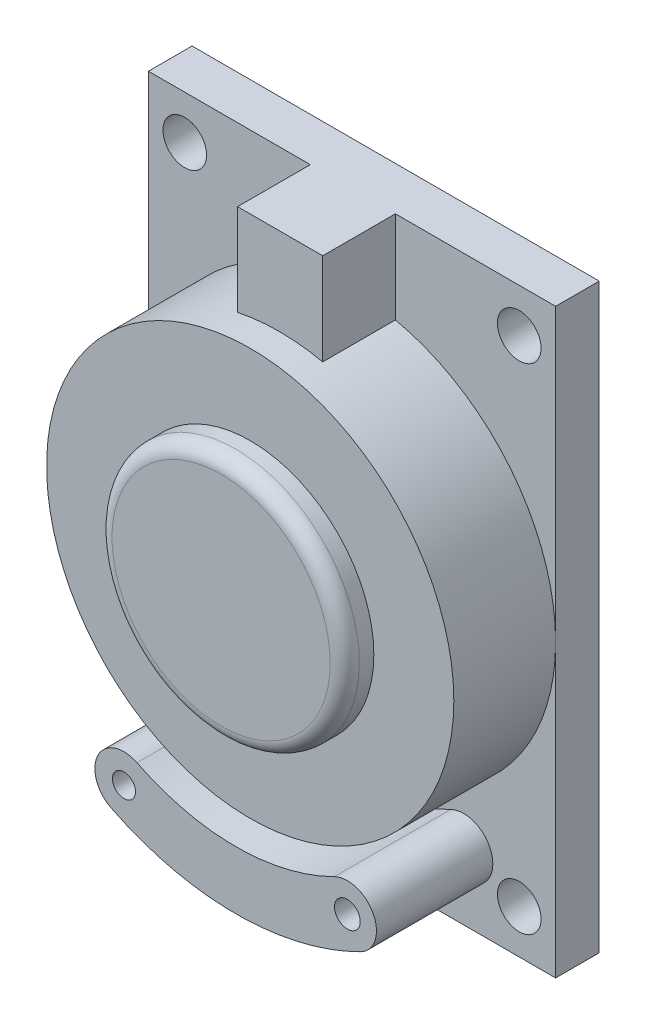
from build123d import *

# Parameters (mm, degrees)
SKETCH1_W           = 28
SKETCH1_H           = 40
BOSS_EXTRUDE1_DEPTH = 3
SKETCH2_R           = 14
BOSS_EXTRUDE2_DEPTH = 7
SKETCH3_R           = 8.5
BOSS_EXTRUDE3_DEPTH = 2
FILLET1_R           = 1
SKETCH4_R           = 0.884555984
SKETCH4_R_2         = 0.79363575
BOSS_EXTRUDE4_DEPTH = 8
SKETCH5_W           = 5.850646162
SKETCH5_H           = 7.111200286
BOSS_EXTRUDE5_DEPTH = 5
SKETCH6_R           = 1.5
CUT_EXTRUDE1_DEPTH  = 5
CUT_EXTRUDE2_DEPTH  = 1.5
CUT_EXTRUDE2_DRAFT  = -30
SKETCH8_R           = 6.5
BOSS_EXTRUDE6_DEPTH = 1
FILLET2_R           = 1


with BuildPart() as part:
    # Sketch1 → Boss-Extrude1 (new body)
    with BuildSketch(Plane.XY):
        Rectangle(SKETCH1_W, SKETCH1_H)
    extrude(amount=BOSS_EXTRUDE1_DEPTH)

    # Sketch2 → Boss-Extrude2 (add)
    with BuildSketch(Plane.XY.offset(3)):
        Circle(SKETCH2_R)
    extrude(amount=BOSS_EXTRUDE2_DEPTH)

    # Sketch3 → Boss-Extrude3 (add)
    with BuildSketch(Plane.XY.offset(10)):
        Circle(SKETCH3_R)
    extrude(amount=BOSS_EXTRUDE3_DEPTH)

    # Fillet1
    fillet1_edges = [part.edges().sort_by_distance(p)[0] for p in [
        (-8.5, 0, 12),
    ]]
    fillet(fillet1_edges, radius=FILLET1_R)

    # Sketch4 → Boss-Extrude4 (add)
    with BuildSketch(Plane.XY.offset(3)):
        with BuildLine():
            ThreePointArc((-8.575515757, -17.151031514), (0, -19.175436175), (8.575515757, -17.151031514))
            ThreePointArc((8.575515757, -17.151031514), (9.469942948, -14.467749941), (6.786661375, -13.57332275))
            ThreePointArc((6.786661375, -13.57332275), (0, -15.175436175), (-6.786661375, -13.57332275))
            ThreePointArc((-6.786661375, -13.57332275), (-9.469942948, -14.467749941), (-8.575515757, -17.151031514))
        make_face()
        with Locations((7.681088566, -15.362177132)):
            Circle(SKETCH4_R, mode=Mode.SUBTRACT)
        with Locations((-7.681088566, -15.362177132)):
            Circle(SKETCH4_R_2, mode=Mode.SUBTRACT)
    extrude(amount=BOSS_EXTRUDE4_DEPTH)

    # Sketch5 → Boss-Extrude5 (add)
    with BuildSketch(Plane.XY.offset(3)):
        with Locations((0.05792719, 16.444399857)):
            Rectangle(SKETCH5_W, SKETCH5_H)
    extrude(amount=BOSS_EXTRUDE5_DEPTH)

    # Sketch6 → Cut-Extrude1 (cut)
    with BuildSketch(Plane.XY.offset(3)):
        with Locations((-11.5, 17)):
            Circle(SKETCH6_R)
        with Locations((11.5, 17)):
            Circle(SKETCH6_R)
        with Locations((11.5, -17)):
            Circle(SKETCH6_R)
        with Locations((-11.5, -17)):
            Circle(SKETCH6_R)
    extrude(amount=-CUT_EXTRUDE1_DEPTH, mode=Mode.SUBTRACT)


with BuildPart() as cut_extrude2_tool:
    # Sketch7 → Cut-Extrude2 (with draft: the straight prism first)
    with BuildSketch(Plane(origin=(0, 0, 0), x_dir=(-1, 0, 0), z_dir=(0, 0, -1))):
        with BuildLine():
            ThreePointArc((-12, -5), (0, -17), (12, -5))
            Line((12, -5), (12, 5))
            ThreePointArc((12, 5), (0, 17), (-12, 5))
            Line((-12, 5), (-12, -5))
        make_face()
    extrude(amount=-CUT_EXTRUDE2_DEPTH)
    # Cut-Extrude2: the draft: its side faces are tilted about the plane it starts from
    cut_extrude2_sides = [cut_extrude2_tool.faces().sort_by_distance(p)[0] for p in [
        (-12, 0, 0.75),
        (0, 17, 0.75),
        (12, 0, 0.75),
        (0, -17, 0.75),
    ]]
    draft(cut_extrude2_sides, Plane(origin=(0, 0, 0), x_dir=(-1, 0, 0), z_dir=(0, 0, -1)), CUT_EXTRUDE2_DRAFT)


with BuildPart() as part_1:
    add(part.part)

    # Cut-Extrude2: cut by cut_extrude2_tool
    add(cut_extrude2_tool.part, mode=Mode.SUBTRACT)

    # Sketch8 → Boss-Extrude6 (add)
    with BuildSketch(Plane(origin=(0, 0, 1.5), x_dir=(-1, 0, 0), z_dir=(0, 0, -1))):
        Circle(SKETCH8_R)
    extrude(amount=BOSS_EXTRUDE6_DEPTH)

    # Fillet2
    fillet2_edges = [part_1.edges().sort_by_distance(p)[0] for p in [
        (6.5, 0, 0.5),
    ]]
    fillet(fillet2_edges, radius=FILLET2_R - 0.0001)  # a hair under: the kernel refuses the full size


solid = part_1.part
